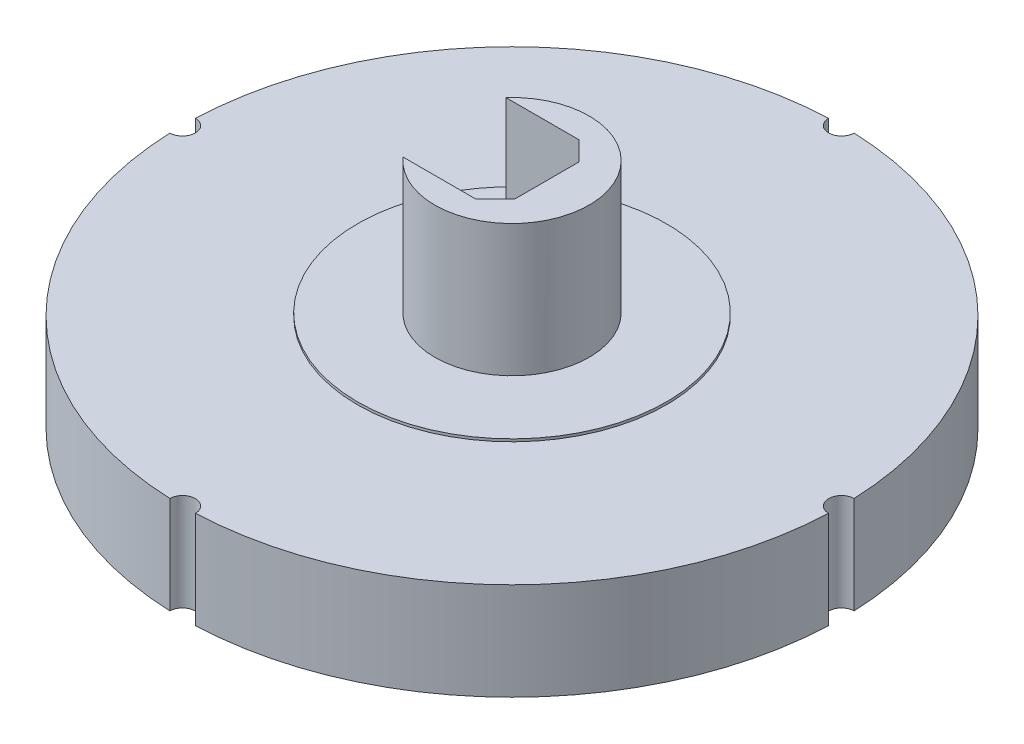
from build123d import *

# Parameters (mm, degrees)
CUT_EXTRUDE1_START      = -4.5
CUT_EXTRUDE1_DEPTH      = 4.5
CHAMFER1_SIZE           = 0.75
CUT_EXTRUDE2_DEPTH      = 21.226619836
CUT_EXTRUDE2_DEPTH_BACK = 21.226619836
SKETCH3_R               = 0.5


# Read off the part's stored shape, not the designer's step: Cut-Extrude1
with BuildPart() as part:
    # Sketch1 → Revolve1 (revolve)
    with BuildSketch(Plane.XY, mode=Mode.PRIVATE) as revolve1_sk:
        Polygon((0, 9.01), (3, 9.01), (3, 3.885), (6, 3.885), (6, 3.785), (12.805, 3.785), (12.805, 0), (0, 0), align=None)
    revolve(revolve1_sk.sketch.rotate(Axis((0, 8.620253165, 0), (0, -1, 0)), 90), axis=Axis((0, 8.620253165, 0), (0, -1, 0)))

    # Cut-Extrude1 outline → Cut-Extrude1 (cut)
    with BuildSketch(Plane(origin=(0, 9.01, 0), x_dir=(1, 0, 0), z_dir=(0, 1, 0)).offset(CUT_EXTRUDE1_START)):
        with BuildLine():
            Line((1.35, -2), (1.35, 2))
            Line((1.35, 2), (-2.236067977, 2))
            ThreePointArc((-2.236067977, 2), (-3, 0), (-2.236067977, -2))
            Line((-2.236067977, -2), (1.35, -2))
        make_face()
    extrude(amount=CUT_EXTRUDE1_DEPTH, mode=Mode.SUBTRACT)

    # Chamfer1
    chamfer1_edges = [part.edges().sort_by_distance(p)[0] for p in [
        (1.35, 6.76, 2),
        (1.35, 4.51, 0),
        (1.35, 6.76, -2),
    ]]
    chamfer(chamfer1_edges, length=CHAMFER1_SIZE)

    # Sketch3 → Cut-Extrude2 (cut, two sides: drawn at the far end of the back side and taken through both)
    with BuildSketch(Plane.XZ.offset(-CUT_EXTRUDE2_DEPTH_BACK)):
        with Locations((0, -12.805)):
            Circle(SKETCH3_R)
        with Locations((-12.805, 0)):
            Circle(SKETCH3_R)
        with Locations((12.805, 0)):
            Circle(SKETCH3_R)
        with Locations((0, 12.805)):
            Circle(SKETCH3_R)
    extrude(amount=CUT_EXTRUDE2_DEPTH + CUT_EXTRUDE2_DEPTH_BACK, mode=Mode.SUBTRACT)


solid = part.part
